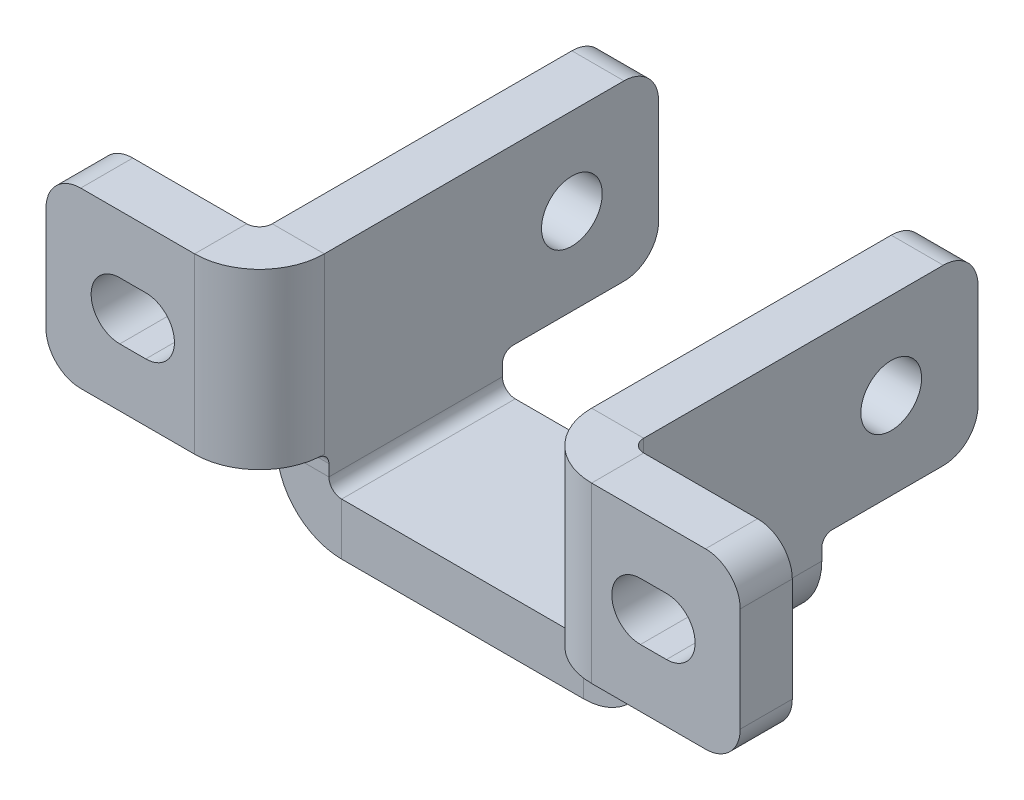
from build123d import *

# Parameters (mm, degrees)
SKETCH1_W                    = 7.7
SKETCH1_H                    = 10
BASE_FLANGE1_DEPTH           = 3
EDGE_FLANGE1_STRIP_W         = 13.4732
EDGE_FLANGE1_STRIP_H         = 3
EDGE_FLANGE1_STRIP_CUT_DEPTH = 10
EDGE_FLANGE1_DEPTH           = 10
TAB1_START                   = -3
TAB1_OUTLINE_W               = 23
TAB1_OUTLINE_H               = 10
TAB1_DEPTH                   = 3
FILLET1_R                    = 0.6
FILLET2_R                    = 2
SKETCH15_R                   = 1.75
CUT_EXTRUDE1_DEPTH           = 22.318771072
EDGE_FLANGE2_START           = 2
EDGE_FLANGE2_DEPTH           = 10
EDGE_FLANGE2_2_DEPTH         = 10
CUT_EXTRUDE2_DEPTH           = 31.724582991
FILLET3_R                    = 2


# Read off the part's stored shape, not the designer's step: Tab1, Edge-Flange2
# Sheet-metal steps are written as plain solids
with BuildPart() as part:
    # Sketch1 → Base-Flange1 (new body)
    with BuildSketch(Plane(origin=(0, 0, 0), x_dir=(1, 0, 0), z_dir=(0, 1, 0))):
        with Locations((3.85, 0)):
            Rectangle(SKETCH1_W, SKETCH1_H)
    extrude(amount=-BASE_FLANGE1_DEPTH)

    # Edge-Flange1 strip (across the edge) → Edge-Flange1 strip cut (cut)
    with BuildSketch(Plane(origin=(7.7, 0, 5), x_dir=(-1, 0, 0), z_dir=(0, 0, -1))):
        with Locations((-6, -1.5)):
            Rectangle(EDGE_FLANGE1_STRIP_W, EDGE_FLANGE1_STRIP_H)
    extrude(amount=EDGE_FLANGE1_STRIP_CUT_DEPTH, mode=Mode.SUBTRACT)

    # Edge-Flange1 section (across the edge) → Edge-Flange1 (add)
    with BuildSketch(Plane(origin=(7.7, 0, 5), x_dir=(-1, 0, 0), z_dir=(0, 0, -1))):
        with BuildLine():
            Line((-3, 0.7366), (-3, 2))
            Line((-3, 2), (0, 2))
            Line((0, 2), (0, 0.7366))
            ThreePointArc((0, 0.7366), (0.215745145, 0.215745145), (0.7366, 0))
            Line((0.7366, 0), (0.7366, -3))
            ThreePointArc((0.7366, -3), (-1.905575199, -1.905575199), (-3, 0.7366))
        make_face()
    extrude(amount=EDGE_FLANGE1_DEPTH)

    # Tab1 outline → Tab1 (add)
    with BuildSketch(Plane(origin=(10.7, 0, 0), x_dir=(0, 0, -1), z_dir=(1, 0, 0)).offset(TAB1_START)):
        with Locations((2.5, 7)):
            Rectangle(TAB1_OUTLINE_W, TAB1_OUTLINE_H)
    extrude(amount=TAB1_DEPTH)

    # Fillet1
    fillet1_edges = [part.edges().sort_by_distance(p)[0] for p in [
        (9.2, 2, 5),
        (9.2, 2, -5),
    ]]
    fillet(fillet1_edges, radius=FILLET1_R)

    # Fillet2
    fillet2_edges = [part.edges().sort_by_distance(p)[0] for p in [
        (9.2, 12, -14),
        (9.2, 2, -14),
    ]]
    fillet(fillet2_edges, radius=FILLET2_R)

    # Sketch15 → Cut-Extrude1 (cut, through all)
    with BuildSketch(Plane(origin=(10.7, 0, 0), x_dir=(0, 0, -1), z_dir=(1, 0, 0))):
        with Locations(Location((9, 7, 0), (0, 0, 90))):
            Circle(SKETCH15_R)
    extrude(amount=-CUT_EXTRUDE1_DEPTH, mode=Mode.SUBTRACT)

    # Edge-Flange2 outline → Edge-Flange2 (cut)
    with BuildSketch(Plane(origin=(0, 0, 0), x_dir=(1, 0, 0), z_dir=(0, 1, 0)).offset(EDGE_FLANGE2_START)):
        with BuildLine():
            Line((10.7, -9), (10.7, -8.926677222))
            ThreePointArc((10.7, -8.926677222), (8.545704021, -7.630867001), (7.7, -5.2634))
            Line((7.7, -5.2634), (7.7, -9))
            Line((7.7, -9), (10.7, -9))
        make_face()
    extrude(amount=EDGE_FLANGE2_DEPTH, mode=Mode.SUBTRACT)

    # Edge-Flange2 2 outline → Edge-Flange2 2 (add)
    with BuildSketch(Plane(origin=(0, 0, 0), x_dir=(1, 0, 0), z_dir=(0, 1, 0)).offset(EDGE_FLANGE2_START)):
        with BuildLine():
            ThreePointArc((10.7, -8.926677222), (11.06647982, -8.981624121), (11.4366, -9))
            Line((11.4366, -9), (20, -9))
            Line((20, -9), (20, -6))
            Line((20, -6), (11.4366, -6))
            ThreePointArc((11.4366, -6), (10.915745145, -5.784254855), (10.7, -5.2634))
            Line((10.7, -5.2634), (10.7, -8.926677222))
        make_face()
    extrude(amount=EDGE_FLANGE2_2_DEPTH)

    # Sketch23 → Cut-Extrude2 (cut, through all)
    with BuildSketch(Plane(origin=(0, 0, 6), x_dir=(-1, 0, 0), z_dir=(0, 0, -1))):
        with BuildLine():
            Line((-15.75, 8.65), (-14.25, 8.65))
            ThreePointArc((-14.25, 8.65), (-12.6, 7), (-14.25, 5.35))
            Line((-14.25, 5.35), (-15.75, 5.35))
            ThreePointArc((-15.75, 5.35), (-17.4, 7), (-15.75, 8.65))
        make_face()
    extrude(amount=-CUT_EXTRUDE2_DEPTH, mode=Mode.SUBTRACT)

    # Fillet3
    fillet3_edges = [part.edges().sort_by_distance(p)[0] for p in [
        (20, 12, 7.5),
        (20, 2, 7.5),
    ]]
    fillet(fillet3_edges, radius=FILLET3_R)

    # Mirror1: part across plane


with BuildPart() as part_1:
    add(part.part)
    add(part.part.mirror(Plane(origin=(0, -3, -5), x_dir=(0, 0, 1), z_dir=(-1, 0, 0))))


solid = part_1.part
